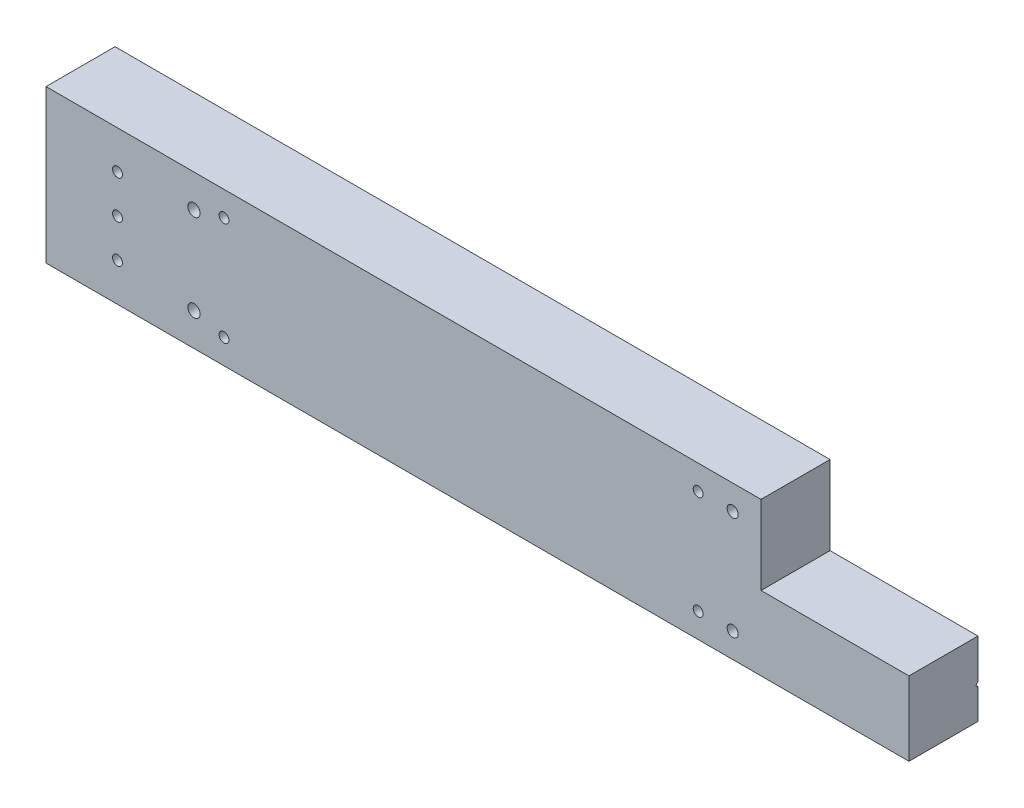
from build123d import *

# Parameters (mm, degrees)
RESSALTO_EXTRUS_O1_DEPTH = 28
ESBO_O2_W                = 280
ESBO_O2_H                = 52
CORTE_EXTRUS_O1_DEPTH    = 23
FILETE6_R                = 5
RESSALTO_EXTRUS_O2_DEPTH = 10
ESBO_O4_R                = 2
CORTE_EXTRUS_O3_DEPTH    = 357.192363759
ESBO_O5_R                = 2
CORTE_EXTRUS_O4_DEPTH    = 357.192363759
ESBO_O6_R                = 2.25
CORTE_EXTRUS_O5_DEPTH    = 356.76537212
ESBO_O7_R                = 2.5
CORTE_EXTRUS_O6_DEPTH    = 10
ESBO_O13_R               = 2
CORTE_EXTRUS_O12_DEPTH   = 357.192363759
ESBO_O15_W               = 30
ESBO_O15_H               = 10
CORTE_EXTRUS_O13_DEPTH   = 4
ESBO_O16_R               = 0.75
CORTE_EXTRUS_O14_DEPTH   = 318.376747731
FILETE7_R                = 5
ESBO_O17_R               = 2
CORTE_EXTRUS_O15_DEPTH   = 10


with BuildPart() as part:
    # Esboço1 → Ressalto-extrusão1 (new body)
    with BuildSketch(Plane.XY):
        Polygon((350, 30), (290, 30), (290, 62), (0, 62), (0, 0), (290, 0), (350, 0), align=None)
    extrude(amount=RESSALTO_EXTRUS_O1_DEPTH)

    # Esboço2 → Corte-extrusão1 (cut)
    with BuildSketch(Plane(origin=(0, 0, 0), x_dir=(-1, 0, 0), z_dir=(0, 0, -1))):
        with Locations((-145, 31)):
            Rectangle(ESBO_O2_W, ESBO_O2_H)
    extrude(amount=-CORTE_EXTRUS_O1_DEPTH, mode=Mode.SUBTRACT)

    # Filete6
    filete6_edges = [part.edges().sort_by_distance(p)[0] for p in [
        (285, 5, 11.5),
        (285, 57, 11.5),
        (5, 57, 11.5),
        (5, 5, 11.5),
    ]]
    fillet(filete6_edges, radius=FILETE6_R)

    # Esboço3 → Ressalto-extrusão2 (add)
    with BuildSketch(Plane(origin=(0, 0, 23), x_dir=(-1, 0, 0), z_dir=(0, 0, -1))):
        with BuildLine():
            Line((-272, 30), (-272, 57))
            Line((-272, 57), (-280, 57))
            ThreePointArc((-280, 57), (-283.535533906, 55.535533906), (-285, 52))
            Line((-285, 52), (-285, 10))
            ThreePointArc((-285, 10), (-283.535533906, 6.464466094), (-280, 5))
            Line((-280, 5), (-272, 5))
            Line((-272, 5), (-272, 30))
        make_face()
    extrude(amount=RESSALTO_EXTRUS_O2_DEPTH)

    # Esboço4 → Corte-extrusão3 (cut, through all)
    with BuildSketch(Plane(origin=(0, 0, 23), x_dir=(-1, 0, 0), z_dir=(0, 0, -1))):
        with Locations((-72.2, 10)):
            Circle(ESBO_O4_R)
        with Locations((-72.2, 52)):
            Circle(ESBO_O4_R)
    extrude(amount=-CORTE_EXTRUS_O3_DEPTH, mode=Mode.SUBTRACT)

    # Esboço5 → Corte-extrusão4 (cut, through all)
    with BuildSketch(Plane(origin=(0, 0, 23), x_dir=(-1, 0, 0), z_dir=(0, 0, -1))):
        with Locations((-264.5, 52)):
            Circle(ESBO_O5_R)
        with Locations((-264.5, 10)):
            Circle(ESBO_O5_R)
    extrude(amount=-CORTE_EXTRUS_O4_DEPTH, mode=Mode.SUBTRACT)

    # Esboço6 → Corte-extrusão5 (cut, through all)
    with BuildSketch(Plane(origin=(0, 0, 13), x_dir=(-1, 0, 0), z_dir=(0, 0, -1))):
        with Locations((-278.5, 10)):
            Circle(ESBO_O6_R)
        with Locations((-278.5, 52)):
            Circle(ESBO_O6_R)
    extrude(amount=-CORTE_EXTRUS_O5_DEPTH, mode=Mode.SUBTRACT)

    # Esboço7 → Corte-extrusão6 (cut)
    with BuildSketch(Plane(origin=(0, 0, 23), x_dir=(-1, 0, 0), z_dir=(0, 0, -1))):
        with Locations((-60, 48.7)):
            Circle(ESBO_O7_R)
        with Locations((-60, 13.3)):
            Circle(ESBO_O7_R)
    extrude(amount=-CORTE_EXTRUS_O6_DEPTH, mode=Mode.SUBTRACT)

    # Esboço13 → Corte-extrusão12 (cut, through all)
    with BuildSketch(Plane(origin=(0, 0, 23), x_dir=(-1, 0, 0), z_dir=(0, 0, -1))):
        with Locations((-29, 46.5)):
            Circle(ESBO_O13_R)
        with Locations((-29, 31)):
            Circle(ESBO_O13_R)
        with Locations((-29, 15.5)):
            Circle(ESBO_O13_R)
    extrude(amount=-CORTE_EXTRUS_O12_DEPTH, mode=Mode.SUBTRACT)

    # Esboço15 → Corte-extrusão13 (cut)
    with BuildSketch(Plane(origin=(0, 0, 0), x_dir=(-1, 0, 0), z_dir=(0, 0, -1))):
        with Locations((-295, 13)):
            Rectangle(ESBO_O15_W, ESBO_O15_H)
    extrude(amount=-CORTE_EXTRUS_O13_DEPTH, mode=Mode.SUBTRACT)

    # Esboço16 → Corte-extrusão14 (cut, through all)
    with BuildSketch(Plane.ZY.offset(-310)):
        with Locations((0, 13)):
            Circle(ESBO_O16_R)
    extrude(amount=-CORTE_EXTRUS_O14_DEPTH, mode=Mode.SUBTRACT)

    # Filete7
    # the kernel refuses this fillet: 5 mm, written as the material it adds along each edge
    with BuildSketch(Plane(origin=(310, 18, 0), x_dir=(-1, 0, 0), z_dir=(0, 0, 1))) as filete7_piece_1_section:
        with BuildLine():
            CenterArc((FILETE7_R, FILETE7_R), FILETE7_R, 180, 90)
            Line((0, FILETE7_R), (0, 0))
            Line((0, 0), (FILETE7_R, 0))
        make_face()
    filete7_piece_1 = extrude(amount=16.5, mode=Mode.PRIVATE)
    filete7_piece_1 = filete7_piece_1 - Plane(origin=(308.865698772, 13, 0), x_dir=(0, 0, 1), z_dir=(-1, 0, 0)) * Cylinder(0.75, 53, mode=Mode.PRIVATE)
    add(filete7_piece_1)
    with BuildSketch(Plane(origin=(310, 8, 0), x_dir=(-1, 0, 0), z_dir=(0, 0, 1))) as filete7_piece_2_section:
        with BuildLine():
            CenterArc((FILETE7_R, -FILETE7_R), FILETE7_R, 90, 90)
            Line((0, -FILETE7_R), (0, 0))
            Line((0, 0), (FILETE7_R, 0))
        make_face()
    filete7_piece_2 = extrude(amount=16.5, mode=Mode.PRIVATE)
    filete7_piece_2 = filete7_piece_2 - Plane(origin=(308.865698858, 13, 0), x_dir=(0, 0, 1), z_dir=(-1, 0, 0)) * Cylinder(0.75, 54, mode=Mode.PRIVATE)
    add(filete7_piece_2)

    # Esboço17 → Corte-extrusão15 (cut)
    with BuildSketch(Plane(origin=(0, 0, 0), x_dir=(-1, 0, 0), z_dir=(0, 0, -1))):
        with Locations((-294.791287847, 4)):
            Circle(ESBO_O17_R)
        with Locations((-295, 22)):
            Circle(ESBO_O17_R)
    extrude(amount=-CORTE_EXTRUS_O15_DEPTH, mode=Mode.SUBTRACT)


solid = part.part
